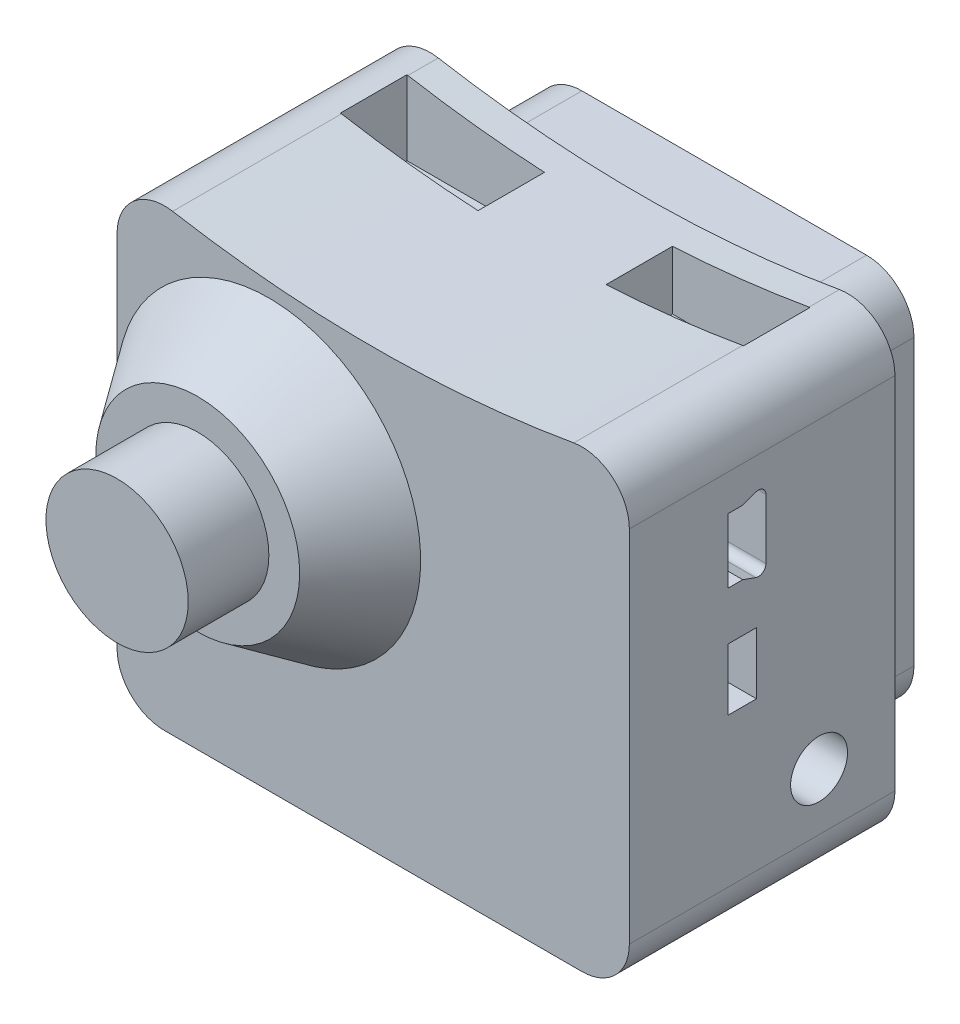
from build123d import *

# Parameters (mm, degrees)
BOSS_EXTRU_1_DEPTH      = 28
ESQUISSE2_R             = 7.5
BOSS_EXTRU_2_DEPTH      = 16
ESQUISSE3_R             = 16
BOSS_EXTRU_3_DEPTH      = 7.5
CHANFREIN2_SIZE2        = 5.251556537
CHANFREIN2_SIZE         = 7.5
ESQUISSE4_R             = 1.25
ENL_V_MAT_EXTRU_1_DEPTH = 7.5
ESQUISSE5_W             = 40
ESQUISSE5_H             = 40
ESQUISSE5_R             = 18.9
ESQUISSE5_R_2           = 10
BOSS_EXTRU_4_DEPTH      = 9
ESQUISSE7_W             = 14.5
ESQUISSE7_H             = 7
ENL_V_MAT_EXTRU_2_DEPTH = 9
ESQUISSE8_W             = 3
ESQUISSE8_H             = 10
ENL_V_MAT_EXTRU_3_DEPTH = 9
ESQUISSE9_R             = 3
ESQUISSE9_W             = 3
ESQUISSE9_H             = 6.5
ENL_V_MAT_EXTRU_4_DEPTH = 9
CONG_2_R                = 5


# Some blends are built 0.0001 mm under size
with BuildPart() as part:
    # Esquisse1 → Boss.-Extru.1 (new body)
    with BuildSketch(Plane.XY):
        with BuildLine():
            Line((-27, 0), (27, 0))
            Line((27, 0), (27, 49))
            ThreePointArc((27, 49), (0, 46), (-27, 49))
            Line((-27, 49), (-27, 0))
        make_face()
    extrude(amount=BOSS_EXTRU_1_DEPTH)

    # Esquisse2 → Boss.-Extru.2 (add)
    with BuildSketch(Plane.XY.offset(28)):
        with Locations((-11, 29)):
            Circle(ESQUISSE2_R)
    extrude(amount=BOSS_EXTRU_2_DEPTH)

    # Esquisse3 → Boss.-Extru.3 (add)
    with BuildSketch(Plane.XY.offset(28)):
        with Locations(Location((-11, 29, 0), (0, 0, 180))):
            Circle(ESQUISSE3_R)
    extrude(amount=BOSS_EXTRU_3_DEPTH)

    # Chanfrein2
    chanfrein2_edges = [part.edges().sort_by_distance(p)[0] for p in [
        (5, 29, 35.5),
    ]]
    chanfrein2_side = [part.faces().sort_by_distance(p)[0] for p in [
        (5, 29, 35.394968869),
    ]]
    chamfer(chanfrein2_edges, length=CHANFREIN2_SIZE - 0.0001, length2=CHANFREIN2_SIZE2 - 0.0001, reference=chanfrein2_side[0])  # a hair under: the kernel refuses the full size

    # Esquisse4 → Enlèv. mat.-Extru.1 (cut)
    with BuildSketch(Plane.XZ):
        with Locations(Location((-13, 5.5, 0), (0, 0, 270))):
            Circle(ESQUISSE4_R)
        with Locations(Location((13, 5.5, 0), (0, 0, 270))):
            Circle(ESQUISSE4_R)
    extrude(amount=-ENL_V_MAT_EXTRU_1_DEPTH, mode=Mode.SUBTRACT)

    # Esquisse5 → Boss.-Extru.4 (add)
    # profile 1 of 2: a face of its own
    with BuildSketch(Plane(origin=(0, 0, 0), x_dir=(-1, 0, 0), z_dir=(0, 0, -1))):
        with Locations((0, 23.4)):
            Rectangle(ESQUISSE5_W, ESQUISSE5_H)
        with Locations((0, 23.4)):
            Circle(ESQUISSE5_R, mode=Mode.SUBTRACT)
    # profile 2 of 2: a face of its own
    with BuildSketch(Plane(origin=(0, 0, 0), x_dir=(-1, 0, 0), z_dir=(0, 0, -1))):
        with Locations(Location((0, 23.4, 0), (0, 0, 180))):
            Circle(ESQUISSE5_R_2)
    extrude(amount=BOSS_EXTRU_4_DEPTH)

    # Esquisse7 → Enlèv. mat.-Extru.2 (cut)
    with BuildSketch(Plane(origin=(0, 49, 0), x_dir=(1, 0, 0), z_dir=(0, 1, 0))):
        with Locations((-14, -6.7)):
            Rectangle(ESQUISSE7_W, ESQUISSE7_H)
        with Locations((14, -6.7)):
            Rectangle(ESQUISSE7_W, ESQUISSE7_H)
    extrude(amount=-ENL_V_MAT_EXTRU_2_DEPTH, mode=Mode.SUBTRACT)

    # Esquisse8 → Enlèv. mat.-Extru.3 (cut)
    with BuildSketch(Plane.ZY.offset(27)):
        with BuildLine():
            Line((14.6, 27), (14.6, 20.5))
            Line((14.6, 20.5), (16.6, 20.5))
            ThreePointArc((16.6, 20.5), (17.307106781, 20.792893219), (17.6, 21.5))
            Line((17.6, 21.5), (17.6, 26))
            ThreePointArc((17.6, 26), (17.307106781, 26.707106781), (16.6, 27))
            Line((16.6, 27), (14.6, 27))
        make_face()
        with Locations((16.1, 34)):
            Rectangle(ESQUISSE8_W, ESQUISSE8_H)
    extrude(amount=-ENL_V_MAT_EXTRU_3_DEPTH, mode=Mode.SUBTRACT)

    # Esquisse9 → Enlèv. mat.-Extru.4 (cut)
    with BuildSketch(Plane(origin=(27, 0, 0), x_dir=(0, 0, -1), z_dir=(1, 0, 0))):
        with Locations(Location((-8, 11, 0), (0, 0, 90))):
            Circle(ESQUISSE9_R)
        with BuildLine():
            Line((-17.6, 39.1), (-17.6, 32.3))
            Line((-17.6, 32.3), (-16.047354824, 32.3))
            Line((-16.047354824, 32.3), (-14.673616115, 31.8))
            ThreePointArc((-14.673616115, 31.8), (-13.941138851, 31.896432461), (-13.6, 32.551754097))
            Line((-13.6, 32.551754097), (-13.6, 38.848245903))
            ThreePointArc((-13.6, 38.848245903), (-13.941138851, 39.503567539), (-14.673616115, 39.6))
            Line((-14.673616115, 39.6), (-16.047354824, 39.1))
            Line((-16.047354824, 39.1), (-17.6, 39.1))
        make_face()
        with Locations((-16.1, 23.95)):
            Rectangle(ESQUISSE9_W, ESQUISSE9_H)
    extrude(amount=-ENL_V_MAT_EXTRU_4_DEPTH, mode=Mode.SUBTRACT)

    # Congé2
    # the kernel refuses this fillet: 5 mm, written as the material it takes off along each edge
    with BuildSketch(Plane(origin=(20, 3.4, 0), x_dir=(-1, 0, 0), z_dir=(0, 0, -1)), Plane(origin=(-20, 3.4, 0), x_dir=(0, 1, 0), z_dir=(0, 0, -1)), Plane(origin=(20, 43.4, 0), x_dir=(0, -1, 0), z_dir=(0, 0, -1))) as cong_2_piece_1:
        with BuildLine():
            CenterArc((CONG_2_R, CONG_2_R), CONG_2_R, 180, 90)
            Line((0, CONG_2_R), (0, 0))
            Line((0, 0), (CONG_2_R, 0))
        make_face()
    extrude(amount=21.5, mode=Mode.SUBTRACT)
    with BuildSketch(Plane(origin=(-20, 43.4, 0), x_dir=(0, -1, 0), z_dir=(0, 0, -1))) as cong_2_piece_2:
        with BuildLine():
            CenterArc((CONG_2_R, -CONG_2_R), CONG_2_R, 90, 90)
            Line((0, -CONG_2_R), (0, 0))
            Line((0, 0), (CONG_2_R, 0))
        make_face()
    extrude(amount=21.5, mode=Mode.SUBTRACT)
    with BuildSketch(Plane(origin=(-27, 49, -15.238005323), x_dir=(0.9806535629636468, -0.19575134596396773, 0), z_dir=(0, 0, 1))) as cong_2_piece_3:
        with BuildLine():
            CenterArc((6.096411836, -4.998524955), CONG_2_R, 91.391765025, 99.896853443)
            Line((1.193144021, -5.977281685), (0, 0))
            ThreePointArc((0, 0), (2.987484684, -0.036286103), (5.974969369, 0))
        make_face()
    extrude(amount=58.476010646, mode=Mode.SUBTRACT)
    with BuildSketch(Plane(origin=(-27, 0, -12.5), x_dir=(1, 0, 0), z_dir=(0, 0, 1)), Plane(origin=(27, 0, -12.5), x_dir=(0, 1, 0), z_dir=(0, 0, 1))) as cong_2_piece_4:
        with BuildLine():
            CenterArc((CONG_2_R, CONG_2_R), CONG_2_R, 180, 90)
            Line((0, CONG_2_R), (0, 0))
            Line((0, 0), (CONG_2_R, 0))
        make_face()
    extrude(amount=53, mode=Mode.SUBTRACT)
    with BuildSketch(Plane(origin=(27, 49, -15.238005323), x_dir=(-0.9806535629636471, -0.19575134596396557, 0), z_dir=(0, 0, 1))) as cong_2_piece_5:
        with BuildLine():
            CenterArc((6.096411836, 4.998524955), CONG_2_R, 168.711381533, 99.896853443)
            Line((1.193144021, 5.977281685), (0, 0))
            ThreePointArc((0, 0), (2.987484684, 0.036286103), (5.974969369, 0))
        make_face()
    extrude(amount=58.476010646, mode=Mode.SUBTRACT)


solid = part.part
